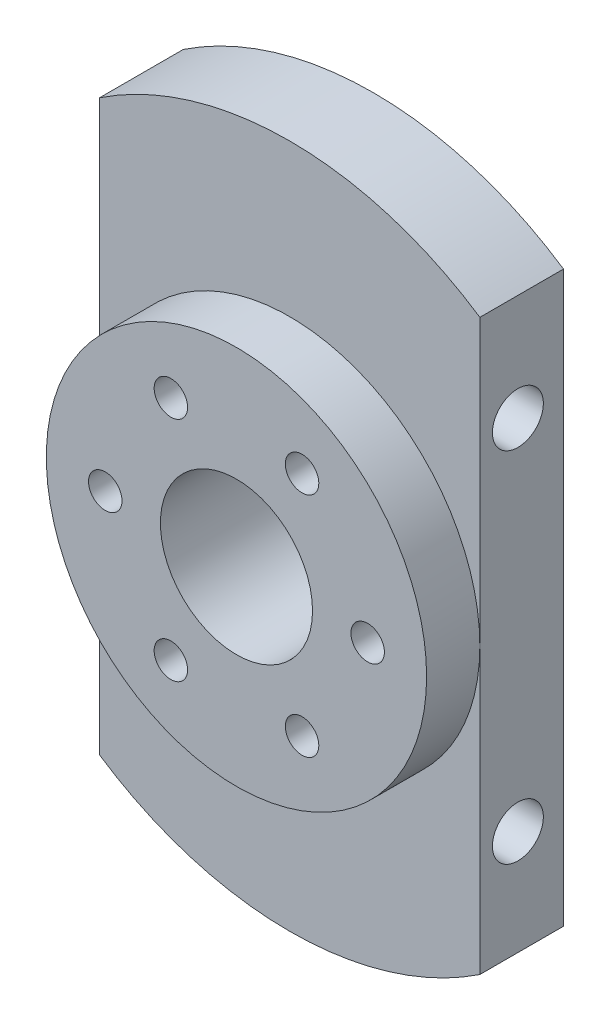
from build123d import *

# Parameters (mm, degrees)
SKETCH_1_R           = 45
EXTRUDE_1_DEPTH      = 15
SKETCH_6_R           = 10
CUT_EXTRUDE_5_DEPTH  = 26
SKETCH_7_R           = 2.2
CUT_EXTRUDE_6_DEPTH  = 66.383484153
CUT_EXTRUDE_7_DEPTH  = 66.383484153
SKETCH_9_R           = 3.35
CUT_EXTRUDE_8_DEPTH  = 69.92024376
SKETCH_11_R          = 4
CUT_EXTRUDE_9_DEPTH  = 9
CUT_EXTRUDE_START    = -4
CUT_EXTRUDE_10_DEPTH = 4
EXTRUDE_START        = 3
SKETCH_14_R          = 25
SKETCH_14_R_2        = 2.2
SKETCH_14_R_3        = 10
EXTRUDE_2_DEPTH      = 3


with BuildPart() as part:
    # 草图1 → 凸台-拉伸1 (new body)
    with BuildSketch(Plane.XY):
        Circle(SKETCH_1_R)
    extrude(amount=EXTRUDE_1_DEPTH)

    # 草图6 → 切除-拉伸5 (cut)
    with BuildSketch(Plane.XY.offset(15)):
        Circle(SKETCH_6_R)
    extrude(amount=-CUT_EXTRUDE_5_DEPTH, mode=Mode.SUBTRACT)

    # 草图7 → 切除-拉伸6 (cut, through all)
    with BuildSketch(Plane.XY.offset(15)):
        with Locations((17.25, 0)):
            Circle(SKETCH_7_R)
        with Locations((8.625, -14.938938215)):
            Circle(SKETCH_7_R)
        with Locations((-8.625, -14.938938215)):
            Circle(SKETCH_7_R)
        with Locations((-17.25, 0)):
            Circle(SKETCH_7_R)
        with Locations((-8.625, 14.938938215)):
            Circle(SKETCH_7_R)
        with Locations((8.625, 14.938938215)):
            Circle(SKETCH_7_R)
    extrude(amount=-CUT_EXTRUDE_6_DEPTH, mode=Mode.SUBTRACT)

    # 草图8 → 切除-拉伸7 (cut, through all)
    with BuildSketch(Plane.XY.offset(15)):
        with BuildLine():
            ThreePointArc((-25, 37.416573868), (-45, 0), (-25, -37.416573868))
            Line((-25, -37.416573868), (-25, 37.416573868))
        make_face()
        with BuildLine():
            Line((25, 37.416573868), (25, -37.416573868))
            ThreePointArc((25, -37.416573868), (45, 0), (25, 37.416573868))
        make_face()
    extrude(amount=-CUT_EXTRUDE_7_DEPTH, mode=Mode.SUBTRACT)

    # 草图9 → 切除-拉伸8 (cut, through all)
    with BuildSketch(Plane(origin=(25, 0, 0), x_dir=(0, 0, -1), z_dir=(1, 0, 0))):
        with Locations((-6, 23.45)):
            Circle(SKETCH_9_R)
        with Locations((-6, -23.63)):
            Circle(SKETCH_9_R)
    extrude(amount=-CUT_EXTRUDE_8_DEPTH, mode=Mode.SUBTRACT)

    # 草图11 → 切除-拉伸9 (cut)
    with BuildSketch(Plane(origin=(0, 0, 0), x_dir=(-1, 0, 0), z_dir=(0, 0, -1))):
        with Locations((-8.625, 14.938938215)):
            Circle(SKETCH_11_R)
        with Locations((-17.25, 0)):
            Circle(SKETCH_11_R)
        with Locations((-8.625, -14.938938215)):
            Circle(SKETCH_11_R)
        with Locations((8.625, 14.938938215)):
            Circle(SKETCH_11_R)
        with Locations((8.625, -14.938938215)):
            Circle(SKETCH_11_R)
        with Locations((17.25, 0)):
            Circle(SKETCH_11_R)
    extrude(amount=-CUT_EXTRUDE_9_DEPTH, mode=Mode.SUBTRACT)

    # 草图13 → 切除-拉伸10 (cut)
    with BuildSketch(Plane.XY.offset(15).offset(CUT_EXTRUDE_START)):
        with BuildLine():
            ThreePointArc((25, 37.416573868), (0, 45), (-25, 37.416573868))
            Line((-25, 37.416573868), (-25, 2.6e-08))
            ThreePointArc((-25, 2.6e-08), (1.3e-08, 25), (25, 0))
            Line((25, 0), (25, 37.416573868))
        make_face()
        with BuildLine():
            ThreePointArc((25, 0), (-1.3e-08, -25), (-25, 2.6e-08))
            Line((-25, 2.6e-08), (-25, -37.416573868))
            ThreePointArc((-25, -37.416573868), (0, -45), (25, -37.416573868))
            Line((25, -37.416573868), (25, 0))
        make_face()
    extrude(amount=CUT_EXTRUDE_10_DEPTH, mode=Mode.SUBTRACT)

    # 草图14 → 凸台-拉伸2 (add)
    with BuildSketch(Plane.XY.offset(15).offset(EXTRUDE_START)):
        Circle(SKETCH_14_R)
        with Locations((8.625, 14.938938215)):
            Circle(SKETCH_14_R_2, mode=Mode.SUBTRACT)
        with Locations((17.25, 0)):
            Circle(SKETCH_14_R_2, mode=Mode.SUBTRACT)
        Circle(SKETCH_14_R_3, mode=Mode.SUBTRACT)
        with Locations((8.625, -14.938938215)):
            Circle(SKETCH_14_R_2, mode=Mode.SUBTRACT)
        with Locations((-8.625, -14.938938215)):
            Circle(SKETCH_14_R_2, mode=Mode.SUBTRACT)
        with Locations((-17.25, 0)):
            Circle(SKETCH_14_R_2, mode=Mode.SUBTRACT)
        with Locations((-8.625, 14.938938215)):
            Circle(SKETCH_14_R_2, mode=Mode.SUBTRACT)
    extrude(amount=-EXTRUDE_2_DEPTH)


solid = part.part
